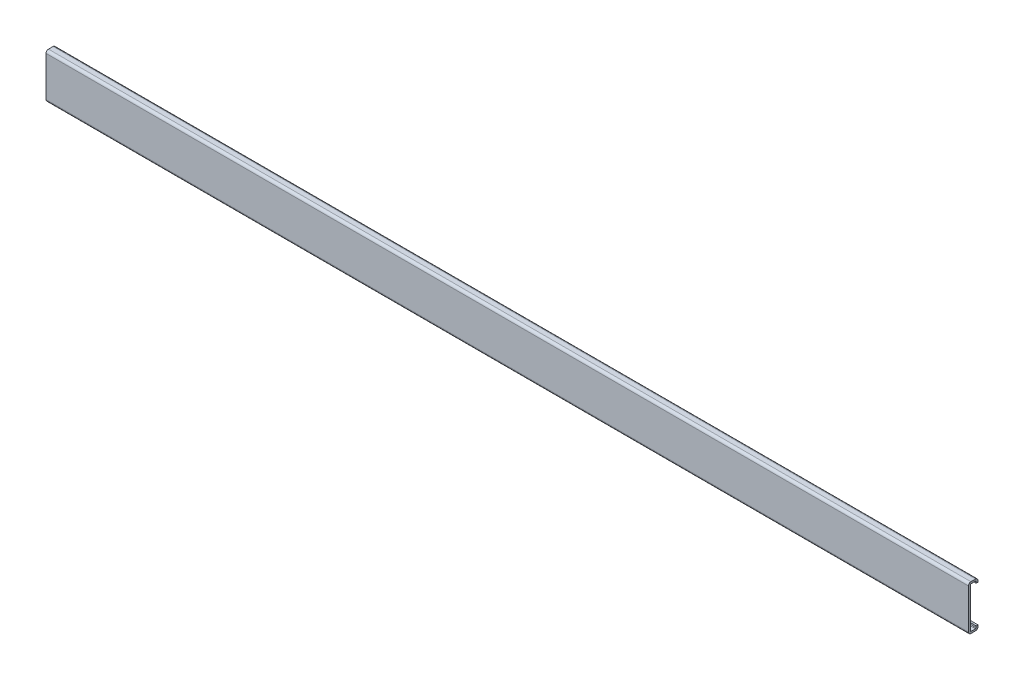
from build123d import *

# Parameters (mm, degrees)
EXTRUDE_1_DEPTH = 600


with BuildPart() as part:
    # Эскиз1 → Вытянуть-Тонкостенный1 (new body)
    with BuildSketch(Plane(origin=(0, 0, 0), x_dir=(0, 0, -1), z_dir=(1, 0, 0))):
        with BuildLine():
            Line((4.4, -12), (4.4, -13))
            ThreePointArc((4.4, -13), (4.282842712, -13.282842712), (4, -13.4))
            Line((4, -13.4), (1, -13.4))
            ThreePointArc((1, -13.4), (0.717157288, -13.282842712), (0.6, -13))
            Line((0.6, -13), (0.6, 13))
            ThreePointArc((0.6, 13), (0.717157288, 13.282842712), (1, 13.4))
            Line((1, 13.4), (4, 13.4))
            ThreePointArc((4, 13.4), (4.282842712, 13.282842712), (4.4, 13))
            Line((4.4, 13), (4.4, 12))
            Line((4.4, 12), (5.6, 12))
            Line((5.6, 12), (5.6, 13))
            ThreePointArc((5.6, 13), (5.13137085, 14.13137085), (4, 14.6))
            Line((4, 14.6), (1, 14.6))
            ThreePointArc((1, 14.6), (-0.13137085, 14.13137085), (-0.6, 13))
            Line((-0.6, 13), (-0.6, -13))
            ThreePointArc((-0.6, -13), (-0.13137085, -14.13137085), (1, -14.6))
            Line((1, -14.6), (4, -14.6))
            ThreePointArc((4, -14.6), (5.13137085, -14.13137085), (5.6, -13))
            Line((5.6, -13), (5.6, -12))
            Line((5.6, -12), (4.4, -12))
        make_face()
    extrude(amount=EXTRUDE_1_DEPTH)


solid = part.part
